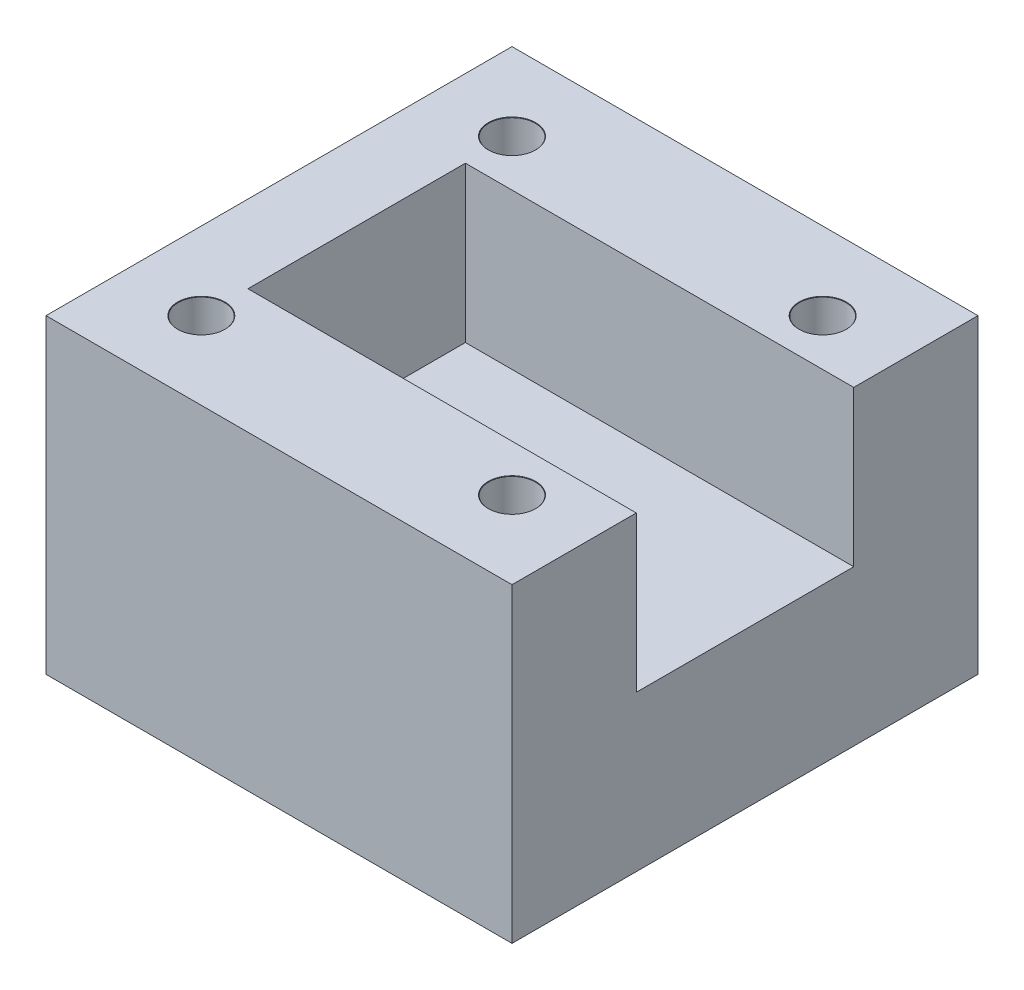
from build123d import *

# Parameters (mm, degrees)
SKETCH1_W                       = 30
SKETCH1_H                       = 30
BOSS_EXTRUDE1_DEPTH             = 20
SKETCH2_W                       = 25
SKETCH2_H                       = 14
CUT_EXTRUDE1_DEPTH              = 10
F_3_0MM_DOWEL_HOLE2_D           = 3
F_3_0MM_DOWEL_HOLE2_CSINK_D     = 3.05
F_3_0MM_DOWEL_HOLE2_CSINK_ANGLE = 90


with BuildPart() as part:
    # Sketch1 → Boss-Extrude1 (new body)
    with BuildSketch(Plane(origin=(0, 23.000010001, 0), x_dir=(1, 0, 0), z_dir=(0, 1, 0))):
        with Locations((-288.366400725, -220.984060818)):
            Rectangle(SKETCH1_W, SKETCH1_H)
    extrude(amount=BOSS_EXTRUDE1_DEPTH)

    # Sketch2 → Cut-Extrude1 (cut)
    with BuildSketch(Plane(origin=(0, 43.000010001, 0), x_dir=(1, 0, 0), z_dir=(0, 1, 0))):
        with Locations((-285.866400725, -220.984060818)):
            Rectangle(SKETCH2_W, SKETCH2_H)
    extrude(amount=-CUT_EXTRUDE1_DEPTH, mode=Mode.SUBTRACT)

    # Ø3.0mm Dowel Hole2 (through all)
    with Locations(Plane(origin=(0, 43.000010001, 0), x_dir=(1, 0, 0), z_dir=(0, 1, 0))):
        with Locations((-298.366400725, -210.984060818), (-278.366400725, -210.984060818), (-278.366400725, -230.984060818), (-298.366400725, -230.984060818)):
            CounterSinkHole(F_3_0MM_DOWEL_HOLE2_D / 2, F_3_0MM_DOWEL_HOLE2_CSINK_D / 2, counter_sink_angle=F_3_0MM_DOWEL_HOLE2_CSINK_ANGLE)


solid = part.part
